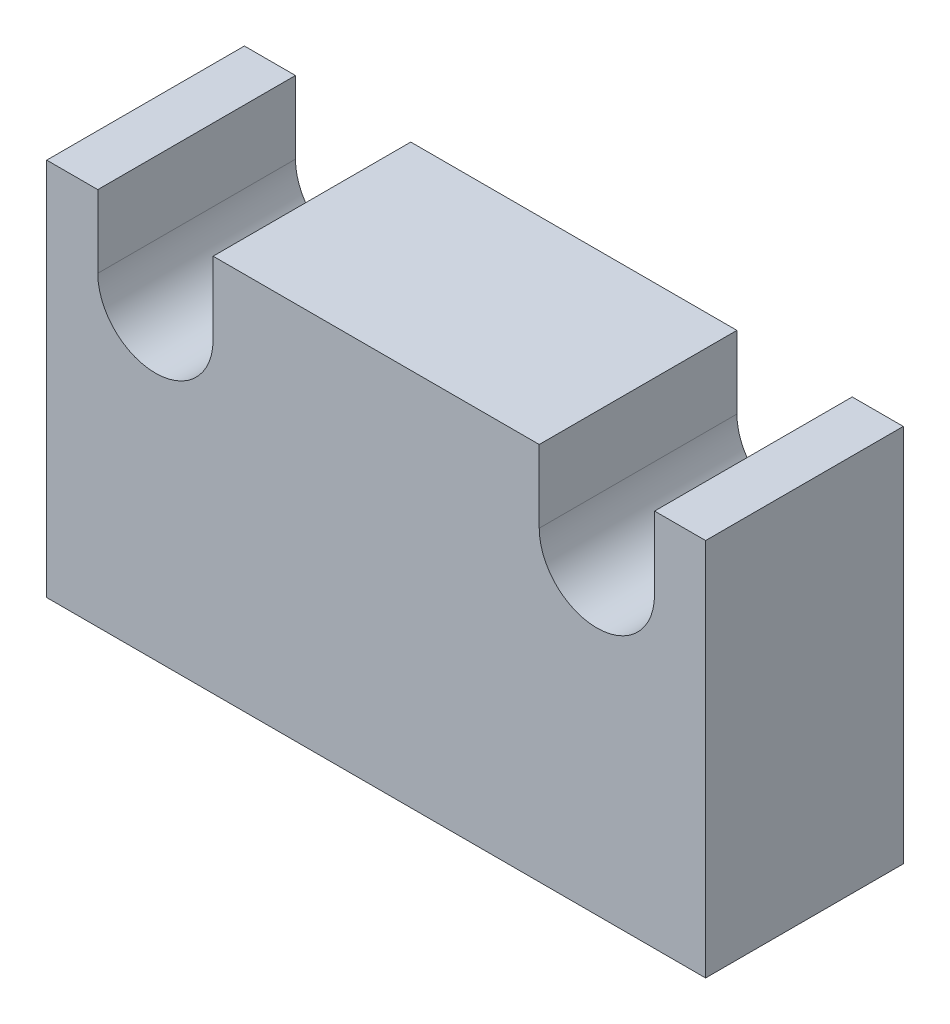
from build123d import *

# Parameters (mm, degrees)
SKETCH1_W           = 20
SKETCH1_H           = 6
BOSS_EXTRUDE1_DEPTH = 11.5
CUT_EXTRUDE1_DEPTH  = 10


with BuildPart() as part:
    # Sketch1 → Boss-Extrude1 (new body)
    with BuildSketch(Plane(origin=(0, 0, 0), x_dir=(1, 0, 0), z_dir=(0, 1, 0))):
        Rectangle(SKETCH1_W, SKETCH1_H)
    extrude(amount=BOSS_EXTRUDE1_DEPTH)

    # Sketch2 → Cut-Extrude1 (cut)
    with BuildSketch(Plane(origin=(0, 0, -3), x_dir=(-1, 0, 0), z_dir=(0, 0, -1))):
        with BuildLine():
            Line((8.45, 11.5), (4.95, 11.5))
            Line((4.95, 11.5), (4.95, 9.3))
            ThreePointArc((4.95, 9.3), (6.7, 7.55), (8.45, 9.3))
            Line((8.45, 9.3), (8.45, 11.5))
        make_face()
        with BuildLine():
            Line((-8.45, 11.5), (-8.45, 9.3))
            ThreePointArc((-8.45, 9.3), (-6.7, 7.55), (-4.95, 9.3))
            Line((-4.95, 9.3), (-4.95, 11.5))
            Line((-4.95, 11.5), (-8.45, 11.5))
        make_face()
    extrude(amount=-CUT_EXTRUDE1_DEPTH, mode=Mode.SUBTRACT)


solid = part.part
